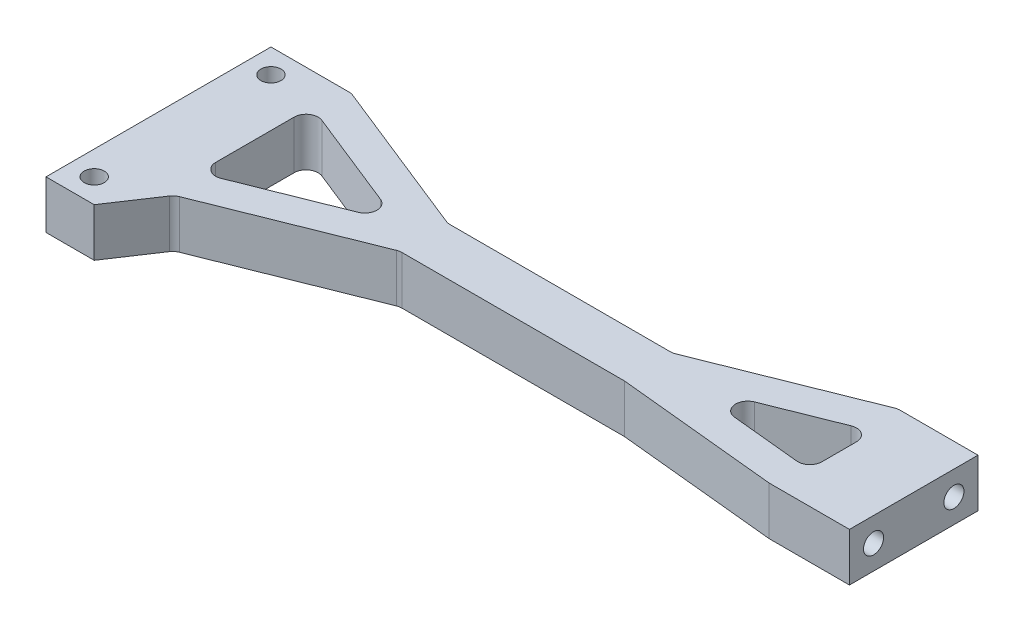
from build123d import *

# Parameters (mm, degrees)
BOSS_EXTRUDE1_DEPTH         = 6
TAP_DRILL_FOR_M3_TAP3_D     = 2.5
TAP_DRILL_FOR_M3_TAP3_DEPTH = 10
TAP_DRILL_FOR_M3_TAP3_TIP   = 0.751075774
TAP_DRILL_FOR_M3_TAP2_D     = 2.5
TAP_DRILL_FOR_M3_TAP2_DEPTH = 8
TAP_DRILL_FOR_M3_TAP2_TIP   = 0.751075774
TAP_DRILL_FOR_M3_TAP1_D     = 2.5
TAP_DRILL_FOR_M3_TAP1_DEPTH = 8
TAP_DRILL_FOR_M3_TAP1_TIP   = 0.751075774
FILLET1_R                   = 1.5


with BuildPart() as part:
    # Sketch2 → Boss-Extrude1 (new body)
    with BuildSketch(Plane(origin=(0, 0, 0), x_dir=(1, 0, 0), z_dir=(0, 1, 0))):
        Polygon((58, -8), (78, 0), (88, 0), (88, -16), (78, -16), (58, -14), (30, -14), (10, -22), (6, -28), (0, -28), (0, 0), (10, 0), (30, -8), align=None)
        Polygon((9, -3.908131846), (26.729670386, -11), (9, -18.091868154), align=None, mode=Mode.SUBTRACT)
        Polygon((62.656164188, -10.44566617), (79, -12.080049752), (79, -3.908131846), align=None, mode=Mode.SUBTRACT)
    extrude(amount=BOSS_EXTRUDE1_DEPTH)

    # Tap Drill for M3 Tap3
    with Locations(Plane(origin=(0, 6, 0), x_dir=(1, 0, 0), z_dir=(0, 1, 0))):
        with Locations((3, -3), (3, -25)):
            Hole(TAP_DRILL_FOR_M3_TAP3_D / 2, depth=TAP_DRILL_FOR_M3_TAP3_DEPTH)
            with Locations((0, 0, -(TAP_DRILL_FOR_M3_TAP3_DEPTH + TAP_DRILL_FOR_M3_TAP3_TIP / 2))):  # 118° drill point
                Cone(0, TAP_DRILL_FOR_M3_TAP3_D / 2, TAP_DRILL_FOR_M3_TAP3_TIP, mode=Mode.SUBTRACT)

    # Tap Drill for M3 Tap2
    with Locations(Plane(origin=(88, 0.779165189, 7.640466368), x_dir=(0, 0, -1), z_dir=(1, 0, 0))):
        with Locations((-5.359533632, 2.220834811), (4.640466368, 2.220834811)):
            Hole(TAP_DRILL_FOR_M3_TAP2_D / 2, depth=TAP_DRILL_FOR_M3_TAP2_DEPTH)
            with Locations((0, 0, -(TAP_DRILL_FOR_M3_TAP2_DEPTH + TAP_DRILL_FOR_M3_TAP2_TIP / 2))):  # 118° drill point
                Cone(0, TAP_DRILL_FOR_M3_TAP2_D / 2, TAP_DRILL_FOR_M3_TAP2_TIP, mode=Mode.SUBTRACT)

    # Tap Drill for M3 Tap1
    with Locations(Plane.ZY):
        with Locations((8, 3), (18, 3)):
            Hole(TAP_DRILL_FOR_M3_TAP1_D / 2, depth=TAP_DRILL_FOR_M3_TAP1_DEPTH)
            with Locations((0, 0, -(TAP_DRILL_FOR_M3_TAP1_DEPTH + TAP_DRILL_FOR_M3_TAP1_TIP / 2))):  # 118° drill point
                Cone(0, TAP_DRILL_FOR_M3_TAP1_D / 2, TAP_DRILL_FOR_M3_TAP1_TIP, mode=Mode.SUBTRACT)

    # Fillet1
    fillet1_edges = [part.edges().sort_by_distance(p)[0] for p in [
        (78, 3, 0),
        (58, 3, 8),
        (62.656164188, 3, 10.44566617),
        (79, 3, 12.080049752),
        (79, 3, 3.908131846),
        (30, 3, 14),
        (10, 3, 22),
        (30, 3, 8),
        (10, 3, 0),
        (9, 3, 18.091868154),
        (26.729670386, 3, 11),
        (9, 3, 3.908131846),
    ]]
    fillet(fillet1_edges, radius=FILLET1_R)


solid = part.part
